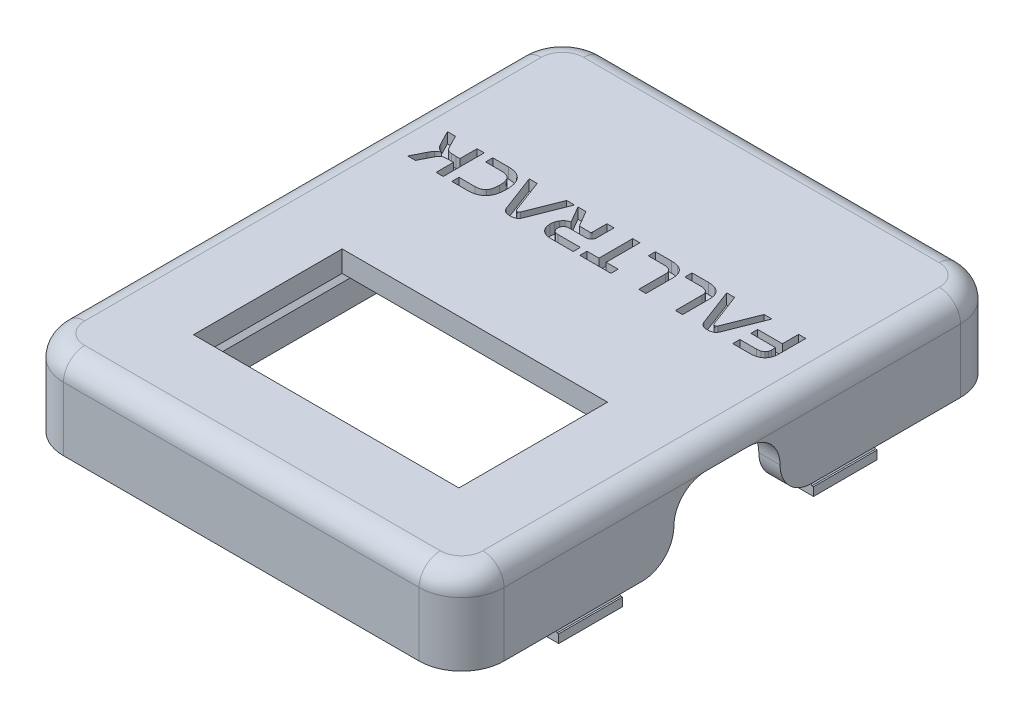
from build123d import *

# Parameters (mm, degrees)
SKETCH1_W            = 41.5
SKETCH1_H            = 51
SKETCH1_W_2          = 37.5
SKETCH1_H_2          = 47
BOSS_EXTRUDE1_DEPTH  = 6
SKETCH2_W            = 41.5
SKETCH2_H            = 51
BOSS_EXTRUDE2_DEPTH  = 2
FILLET1_R            = 4
SKETCH4_R            = 0.95
BOSS_EXTRUDE3_DEPTH  = 5
SKETCH6_W            = 25
SKETCH6_H            = 16.5
CUT_EXTRUDE1_DEPTH   = 34.41874474
SKETCH7_W            = 4.5
SKETCH7_H            = 2
SKETCH7_W_2          = 2.154325197
SKETCH7_H_2          = 4
BOSS_EXTRUDE4_DEPTH  = 5
SKETCH8_R            = 1.95
BOSS_EXTRUDE5_DEPTH  = 3
FILLET2_R            = 2
SKETCH9_W            = 2
SKETCH9_H            = 10
CUT_EXTRUDE2_DEPTH   = 6
FILLET3_R            = 3
SKETCH11_W           = 32
SKETCH11_H           = 3.5
BOSS_EXTRUDE6_DEPTH  = 1.5
CHAMFER1_SIZE        = 1
CHAMFER2_SIZE        = 0.5
SKETCH12_W           = 32
SKETCH12_H           = 0.8
BOSS_EXTRUDE7_DEPTH  = 0.65
CHAMFER3_SIZE        = 0.5
SKETCH13_W           = 6
SKETCH13_H           = 3.5
BOSS_EXTRUDE8_DEPTH  = 1.5
CHAMFER4_START       = -15
CHAMFER4_DEPTH       = 6
CHAMFER4_START_2     = 9
CHAMFER4_2_DEPTH     = 6
SKETCH14_W           = 6
SKETCH14_H           = 0.8
BOSS_EXTRUDE9_DEPTH  = 0.65
CHAMFER5_SIZE        = 0.5
CUT_EXTRUDE4_START   = -1
CUT_EXTRUDE4_DEPTH   = 1
CUT_EXTRUDE5_START   = -3
SKETCH16_R           = 1.95
SKETCH16_R_2         = 0.95
CUT_EXTRUDE5_DEPTH   = 3
CUT_EXTRUDE6_START   = -2
SKETCH17_R           = 0.95
CUT_EXTRUDE6_DEPTH   = 2
CHAMFER6_SIZE        = 2
CUT_EXTRUDE7_DEPTH   = 2
SKETCH18_W           = 25
SKETCH18_H           = 2.5
BOSS_EXTRUDE10_DEPTH = 2


with BuildPart() as part:
    # Sketch1 → Boss-Extrude1 (new body)
    with BuildSketch(Plane(origin=(0, 0, 0), x_dir=(1, 0, 0), z_dir=(0, 1, 0))):
        Rectangle(SKETCH1_W, SKETCH1_H)
        Rectangle(SKETCH1_W_2, SKETCH1_H_2, mode=Mode.SUBTRACT)
    extrude(amount=BOSS_EXTRUDE1_DEPTH)

    # Sketch2 → Boss-Extrude2 (add)
    with BuildSketch(Plane(origin=(0, 6, 0), x_dir=(1, 0, 0), z_dir=(0, 1, 0))):
        Rectangle(SKETCH2_W, SKETCH2_H)
    extrude(amount=BOSS_EXTRUDE2_DEPTH)

    # Fillet1
    fillet1_edges = [part.edges().sort_by_distance(p)[0] for p in [
        (20.75, 4, -25.5),
        (20.75, 4, 25.5),
        (-20.75, 4, 25.5),
        (-20.75, 4, -25.5),
    ]]
    fillet(fillet1_edges, radius=FILLET1_R)

    # Sketch4 → Boss-Extrude3 (add)
    with BuildSketch(Plane.XZ.offset(-6)):
        with Locations(Location((11.05, -2.05, 0), (0, 0, 90))):
            Circle(SKETCH4_R)
        with Locations(Location((11.05, 20.05, 0), (0, 0, 270))):
            Circle(SKETCH4_R)
        with Locations(Location((-11.05, -2.05, 0), (0, 0, 90))):
            Circle(SKETCH4_R)
        with Locations(Location((-11.05, 20.05, 0), (0, 0, 90))):
            Circle(SKETCH4_R)
    extrude(amount=BOSS_EXTRUDE3_DEPTH)

    # Sketch6 → Cut-Extrude1 (cut, through all)
    with BuildSketch(Plane.XZ.offset(-6)):
        with Locations((0, 9.25)):
            Rectangle(SKETCH6_W, SKETCH6_H)
    extrude(amount=-CUT_EXTRUDE1_DEPTH, mode=Mode.SUBTRACT)

    # Sketch7 → Boss-Extrude4 (add)
    with BuildSketch(Plane.XZ.offset(-6)):
        with Locations((-16.5, -22.5)):
            Rectangle(SKETCH7_W, SKETCH7_H)
        with Locations((-16.5, -6.5)):
            Rectangle(SKETCH7_W, SKETCH7_H)
        with Locations((1.077162598, -14.5)):
            Rectangle(SKETCH7_W_2, SKETCH7_H_2)
    extrude(amount=BOSS_EXTRUDE4_DEPTH)

    # Sketch8 → Boss-Extrude5 (add)
    with BuildSketch(Plane.XZ.offset(-6)):
        with Locations(Location((11.05, -2.05, 0), (0, 0, 90))):
            Circle(SKETCH8_R)
        with Locations(Location((-11.05, -2.05, 0), (0, 0, 90))):
            Circle(SKETCH8_R)
        with Locations(Location((11.05, 20.05, 0), (0, 0, 90))):
            Circle(SKETCH8_R)
        with Locations(Location((-11.05, 20.05, 0), (0, 0, 90))):
            Circle(SKETCH8_R)
    extrude(amount=BOSS_EXTRUDE5_DEPTH)

    # Fillet2
    fillet2_edges = [part.edges().sort_by_distance(p)[0] for p in [
        (0, 8, 25.5),
        (-20.75, 8, 0),
        (20.75, 8, 0),
        (0, 8, -25.5),
        (-19.578427125, 8, -24.328427125),
        (19.578427125, 8, -24.328427125),
        (19.578427125, 8, 24.328427125),
        (-19.578427125, 8, 24.328427125),
    ]]
    fillet(fillet2_edges, radius=FILLET2_R)

    # Sketch9 → Cut-Extrude2 (cut)
    with BuildSketch(Plane.XZ):
        with Locations((19.75, 0.5)):
            Rectangle(SKETCH9_W, SKETCH9_H)
    extrude(amount=-CUT_EXTRUDE2_DEPTH, mode=Mode.SUBTRACT)

    # Fillet3
    fillet3_edges = [part.edges().sort_by_distance(p)[0] for p in [
        (19.75, 6, 5.5),
        (19.75, 6, -4.5),
    ]]
    fillet(fillet3_edges, radius=FILLET3_R)
    fillet3_2_edges = [part.edges().sort_by_distance(p)[0] for p in [
        (19.75, 0, 5.5),
        (19.75, 0, -4.5),
    ]]
    fillet(fillet3_2_edges, radius=FILLET3_R - 0.0001)  # a hair under: the kernel refuses the full size

    # Sketch11 → Boss-Extrude6 (add)
    with BuildSketch(Plane(origin=(-18.75, 0, 0), x_dir=(0, 0, -1), z_dir=(1, 0, 0))):
        with Locations((0, -0.75)):
            Rectangle(SKETCH11_W, SKETCH11_H)
    extrude(amount=BOSS_EXTRUDE6_DEPTH)

    # Chamfer1
    chamfer1_edges = [part.edges().sort_by_distance(p)[0] for p in [
        (-18.75, 1, 5.25),
        (-17.25, 1, -11.75),
    ]]
    chamfer(chamfer1_edges, length=CHAMFER1_SIZE)

    # Chamfer2
    chamfer2_edges = [part.edges().sort_by_distance(p)[0] for p in [
        (-17.25, 1, 5.25),
    ]]
    chamfer(chamfer2_edges, length=CHAMFER2_SIZE - 0.0001)  # a hair under: the kernel refuses the full size

    # Sketch12 → Boss-Extrude7 (add)
    with BuildSketch(Plane.ZY.offset(18.75)):
        with Locations((0, -2.1)):
            Rectangle(SKETCH12_W, SKETCH12_H)
    extrude(amount=BOSS_EXTRUDE7_DEPTH)

    # Chamfer3
    chamfer3_edges = [part.edges().sort_by_distance(p)[0] for p in [
        (-18.75, -1.7, 0),
    ]]
    chamfer(chamfer3_edges, length=CHAMFER3_SIZE)

    # Sketch13 → Boss-Extrude8 (add)
    with BuildSketch(Plane.ZY.offset(-18.75)):
        with Locations((12, -0.75)):
            Rectangle(SKETCH13_W, SKETCH13_H)
        with Locations((-12, -0.75)):
            Rectangle(SKETCH13_W, SKETCH13_H)
    extrude(amount=BOSS_EXTRUDE8_DEPTH)

    # Chamfer4: read off the stored shape, not the designer's step
    # Chamfer4 outline → Chamfer4 (add)
    with BuildSketch(Plane.XY.offset(CHAMFER4_START)):
        Polygon((18.75, 3), (17.25, 1.5), (17.25, 1), (18.75, 1), align=None)
    extrude(amount=CHAMFER4_DEPTH)

    # Chamfer4 2 outline → Chamfer4 2 (add)
    with BuildSketch(Plane.XY.offset(CHAMFER4_START_2)):
        Polygon((18.75, 3), (17.25, 1.5), (17.25, 1), (18.75, 1), align=None)
    extrude(amount=CHAMFER4_2_DEPTH)

    # Sketch14 → Boss-Extrude9 (add)
    with BuildSketch(Plane(origin=(18.75, 0, 0), x_dir=(0, 0, -1), z_dir=(1, 0, 0))):
        with Locations((12, -2.1)):
            Rectangle(SKETCH14_W, SKETCH14_H)
        with Locations((-12, -2.1)):
            Rectangle(SKETCH14_W, SKETCH14_H)
    extrude(amount=BOSS_EXTRUDE9_DEPTH)

    # Chamfer5
    chamfer5_edges = [part.edges().sort_by_distance(p)[0] for p in [
        (-17.25, -2.5, 0),
        (17.25, -2.5, 12),
        (17.25, -2.5, -12),
        (18.75, -1.7, -12),
        (18.75, -1.7, 12),
    ]]
    chamfer(chamfer5_edges, length=CHAMFER5_SIZE)

    # Cut-Extrude4: read off the stored shape, not the designer's step
    # Cut-Extrude4 outline → Cut-Extrude4 (cut)
    with BuildSketch(Plane(origin=(0, 8, 0), x_dir=(1, 0, 0), z_dir=(0, 1, 0)).offset(CUT_EXTRUDE4_START)):
        with BuildLine():
            add(Edge.make_bspline(
                [(-15.135868732, 9.429192035), (-15.021534625, 9.419735248), (-14.872939044, 9.41492934), (-14.690081989, 9.41492934)],
                knots=[21, 21, 21, 21, 22, 22, 22, 22], degree=3))
            add(Edge.make_bspline(
                [(-15.421587726, 9.494924457), (-15.345313312, 9.460662982), (-15.250125323, 9.438726337), (-15.135868732, 9.429192035)],
                knots=[20, 20, 20, 20, 21, 21, 21, 21], degree=3))
            add(Edge.make_bspline(
                [(-15.610180865, 9.637783954), (-15.560649005, 9.57685744), (-15.497784625, 9.529185931), (-15.421587726, 9.494924457)],
                knots=[19, 19, 19, 19, 20, 20, 20, 20], degree=3))
            add(Edge.make_bspline(
                [(-15.76451253, 9.883505389), (-15.711104938, 9.780643451), (-15.659635211, 9.698787982), (-15.610180865, 9.637783954)],
                knots=[18, 18, 18, 18, 19, 19, 19, 19], degree=3))
            Line((-15.76451253, 9.883505389), (-16.35315877, 11.026536395))
            Line((-16.35315877, 11.026536395), (-17.107531329, 11.026536395))
            Line((-17.107531329, 11.026536395), (-16.484623614, 9.81498244))
            add(Edge.make_bspline(
                [(-16.318819781, 9.526317889), (-16.372149859, 9.608328387), (-16.427417804, 9.704524066), (-16.484623614, 9.81498244)],
                knots=[14, 14, 14, 14, 15, 15, 15, 15], degree=3))
            add(Edge.make_bspline(
                [(-16.150225421, 9.314857929), (-16.209291583, 9.374001605), (-16.265489703, 9.444462421), (-16.318819781, 9.526317889)],
                knots=[13, 13, 13, 13, 14, 14, 14, 14], degree=3))
            add(Edge.make_bspline(
                [(-15.958841754, 9.166339862), (-16.027364703, 9.206337421), (-16.091159259, 9.255869281), (-16.150225421, 9.314857929)],
                knots=[12, 12, 12, 12, 13, 13, 13, 13], degree=3))
            add(Edge.make_bspline(
                [(-15.718778888, 9.072004535), (-15.810246173, 9.094871356), (-15.89024129, 9.126264789), (-15.958841754, 9.166339862)],
                knots=[11, 11, 11, 11, 12, 12, 12, 12], degree=3))
            add(Edge.make_bspline(
                [(-16.10735982, 8.797680194), (-16.0082961, 8.912014301), (-15.878769122, 9.003404071), (-15.718778888, 9.072004535)],
                knots=[10, 10, 10, 10, 11, 11, 11, 11], degree=3))
            add(Edge.make_bspline(
                [(-16.387420245, 8.369024189), (-16.299751178, 8.540486591), (-16.206423541, 8.683423603), (-16.10735982, 8.797680194)],
                knots=[9, 9, 9, 9, 10, 10, 10, 10], degree=3))
            Line((-16.387420245, 8.369024189), (-16.993197222, 7.168942402))
            Line((-16.993197222, 7.168942402), (-16.267427569, 7.168942402))
            Line((-16.267427569, 7.168942402), (-15.678781329, 8.323368061))
            add(Edge.make_bspline(
                [(-15.527317706, 8.577693622), (-15.5749117, 8.514829242), (-15.625373736, 8.430028217), (-15.678781329, 8.323368061)],
                knots=[5, 5, 5, 5, 6, 6, 6, 6], degree=3))
            add(Edge.make_bspline(
                [(-15.352987262, 8.723421161), (-15.421587726, 8.689082172), (-15.479646197, 8.640558002), (-15.527317706, 8.577693622)],
                knots=[4, 4, 4, 4, 5, 5, 5, 5], degree=3))
            add(Edge.make_bspline(
                [(-15.093003131, 8.789076068), (-15.197725421, 8.779619281), (-15.284464313, 8.757682636), (-15.352987262, 8.723421161)],
                knots=[3, 3, 3, 3, 4, 4, 4, 4], degree=3))
            add(Edge.make_bspline(
                [(-14.690081989, 8.803416278), (-14.853870441, 8.803416278), (-14.988125812, 8.798687885), (-15.093003131, 8.789076068)],
                knots=[2, 2, 2, 2, 3, 3, 3, 3], degree=3))
            Line((-14.690081989, 8.803416278), (-14.318631793, 8.803416278))
            Line((-14.318631793, 8.803416278), (-14.318631793, 7.168942402))
            Line((-14.318631793, 7.168942402), (-13.644254352, 7.168942402))
            Line((-13.644254352, 7.168942402), (-13.644254352, 11.026536395))
            Line((-13.644254352, 11.026536395), (-14.318631793, 11.026536395))
            Line((-14.318631793, 11.026536395), (-14.318631793, 9.41492934))
            Line((-14.318631793, 9.41492934), (-14.690081989, 9.41492934))
        make_face()
        with BuildLine():
            add(Edge.make_bspline(
                [(-10.052380574, 7.646122577), (-10.351432087, 7.32800246), (-10.782956135, 7.168942402), (-11.346875202, 7.168942402)],
                knots=[12, 12, 12, 12, 13, 13, 13, 13], degree=3))
            add(Edge.make_bspline(
                [(-9.603725789, 9.10060744), (-9.603725789, 8.44909682), (-9.753251546, 7.964242694), (-10.052380574, 7.646122577)],
                knots=[11, 11, 11, 11, 12, 12, 12, 12], degree=3))
            add(Edge.make_bspline(
                [(-10.052380574, 10.549356219), (-9.753251546, 10.231236102), (-9.603725789, 9.748319842), (-9.603725789, 9.10060744)],
                knots=[10, 10, 10, 10, 11, 11, 11, 11], degree=3))
            add(Edge.make_bspline(
                [(-11.346875202, 11.026536395), (-10.782956135, 11.026536395), (-10.351432087, 10.867476336), (-10.052380574, 10.549356219)],
                knots=[9, 9, 9, 9, 10, 10, 10, 10], degree=3))
            Line((-11.346875202, 11.026536395), (-12.838489582, 11.026536395))
            Line((-12.838489582, 11.026536395), (-12.838489582, 10.352158954))
            Line((-12.838489582, 10.352158954), (-11.346875202, 10.352158954))
            add(Edge.make_bspline(
                [(-10.529560749, 10.057835834), (-10.697224934, 10.254102923), (-10.969611409, 10.352158954), (-11.346875202, 10.352158954)],
                knots=[5, 5, 5, 5, 6, 6, 6, 6], degree=3))
            add(Edge.make_bspline(
                [(-10.27810323, 9.10060744), (-10.27810323, 9.542595966), (-10.361896565, 9.861646258), (-10.529560749, 10.057835834)],
                knots=[4, 4, 4, 4, 5, 5, 5, 5], degree=3))
            add(Edge.make_bspline(
                [(-10.532428791, 8.137565448), (-10.362904255, 8.333910053), (-10.27810323, 8.654820697), (-10.27810323, 9.10060744)],
                knots=[3, 3, 3, 3, 4, 4, 4, 4], degree=3))
            add(Edge.make_bspline(
                [(-11.346875202, 7.843319843), (-10.973409626, 7.843319843), (-10.701953328, 7.941453388), (-10.532428791, 8.137565448)],
                knots=[2, 2, 2, 2, 3, 3, 3, 3], degree=3))
            Line((-11.346875202, 7.843319843), (-12.838489582, 7.843319843))
            Line((-12.838489582, 7.843319843), (-12.838489582, 7.168942402))
            Line((-12.838489582, 7.168942402), (-11.346875202, 7.168942402))
        make_face()
        with BuildLine():
            add(Edge.make_bspline(
                [(-7.294951986, 7.791850116), (-7.2034847, 7.791850116), (-7.138682454, 7.835723407), (-7.100622762, 7.92331496)],
                knots=[10, 10, 10, 10, 11, 11, 11, 11], degree=3))
            add(Edge.make_bspline(
                [(-7.483545125, 7.92331496), (-7.449283651, 7.835723407), (-7.386419271, 7.791850116), (-7.294951986, 7.791850116)],
                knots=[9, 9, 9, 9, 10, 10, 10, 10], degree=3))
            Line((-7.483545125, 7.92331496), (-8.655101521, 11.026536395))
            Line((-8.655101521, 11.026536395), (-9.40381551, 11.026536395))
            Line((-9.40381551, 11.026536395), (-8.100794271, 7.597520893))
            add(Edge.make_bspline(
                [(-7.800735067, 7.211808002), (-7.93219991, 7.286067035), (-8.032193807, 7.414663837), (-8.100794271, 7.597520893)],
                knots=[5, 5, 5, 5, 6, 6, 6, 6], degree=3))
            add(Edge.make_bspline(
                [(-7.30068807, 7.100341938), (-7.502536214, 7.100341938), (-7.669270223, 7.137471454), (-7.800735067, 7.211808002)],
                knots=[4, 4, 4, 4, 5, 5, 5, 5], degree=3))
            add(Edge.make_bspline(
                [(-6.794904989, 7.211808002), (-6.926369832, 7.137471454), (-7.094964193, 7.100341938), (-7.30068807, 7.100341938)],
                knots=[3, 3, 3, 3, 4, 4, 4, 4], degree=3))
            add(Edge.make_bspline(
                [(-6.489109701, 7.597520893), (-6.561430868, 7.414663837), (-6.663440145, 7.286067035), (-6.794904989, 7.211808002)],
                knots=[2, 2, 2, 2, 3, 3, 3, 3], degree=3))
            Line((-6.489109701, 7.597520893), (-5.134696249, 11.026536395))
            Line((-5.134696249, 11.026536395), (-5.877596639, 11.026536395))
            Line((-5.877596639, 11.026536395), (-7.100622762, 7.92331496))
        make_face()
        with BuildLine():
            add(Edge.make_bspline(
                [(-3.925932821, 7.994705951), (-3.84020162, 7.893859394), (-3.703930868, 7.843319843), (-3.51735311, 7.843319843)],
                knots=[24, 24, 24, 24, 25, 25, 25, 25], degree=3))
            add(Edge.make_bspline(
                [(-4.054529623, 8.351893451), (-4.054529623, 8.214770038), (-4.011664023, 8.095707538), (-3.925932821, 7.994705951)],
                knots=[23, 23, 23, 23, 24, 24, 24, 24], degree=3))
            add(Edge.make_bspline(
                [(-4.023136191, 8.551958759), (-4.043987631, 8.487234027), (-4.054529623, 8.420493915), (-4.054529623, 8.351893451)],
                knots=[22, 22, 22, 22, 23, 23, 23, 23], degree=3))
            add(Edge.make_bspline(
                [(-3.928800863, 8.723421161), (-3.970658774, 8.673889301), (-4.002129721, 8.616761005), (-4.023136191, 8.551958759)],
                knots=[21, 21, 21, 21, 22, 22, 22, 22], degree=3))
            add(Edge.make_bspline(
                [(-3.763074545, 8.843413837), (-3.831675009, 8.81295058), (-3.886865439, 8.772953021), (-3.928800863, 8.723421161)],
                knots=[20, 20, 20, 20, 21, 21, 21, 21], degree=3))
            add(Edge.make_bspline(
                [(-3.51735311, 8.889147479), (-3.612541098, 8.889147479), (-3.694474081, 8.873954608), (-3.763074545, 8.843413837)],
                knots=[19, 19, 19, 19, 20, 20, 20, 20], degree=3))
            Line((-3.51735311, 8.889147479), (-2.014266562, 8.889147479))
            add(Edge.make_bspline(
                [(-1.551349082, 9.032006976), (-1.64653707, 8.936818988), (-1.800868735, 8.889147479), (-2.014266562, 8.889147479)],
                knots=[17, 17, 17, 17, 18, 18, 18, 18], degree=3))
            add(Edge.make_bspline(
                [(-1.408489585, 9.500660541), (-1.408489585, 9.283464496), (-1.456083579, 9.127272479), (-1.551349082, 9.032006976)],
                knots=[16, 16, 16, 16, 17, 17, 17, 17], degree=3))
            Line((-1.408489585, 9.500660541), (-1.408489585, 11.026536395))
            Line((-1.408489585, 11.026536395), (-2.082867026, 11.026536395))
            Line((-2.082867026, 11.026536395), (-2.082867026, 9.63204787))
            add(Edge.make_bspline(
                [(-2.17999288, 9.534922015), (-2.115190634, 9.534922015), (-2.082867026, 9.567323138), (-2.082867026, 9.63204787)],
                knots=[12, 12, 12, 12, 13, 13, 13, 13], degree=3))
            Line((-2.17999288, 9.534922015), (-3.185822958, 9.534922015))
            Line((-3.185822958, 9.534922015), (-4.065924276, 11.026536395))
            Line((-4.065924276, 11.026536395), (-4.814638266, 11.026536395))
            Line((-4.814638266, 11.026536395), (-3.91740621, 9.483452289))
            add(Edge.make_bspline(
                [(-4.294592489, 9.300595233), (-4.191730551, 9.38059035), (-4.065924276, 9.441594379), (-3.91740621, 9.483452289)],
                knots=[7, 7, 7, 7, 8, 8, 8, 8], degree=3))
            add(Edge.make_bspline(
                [(-4.546050009, 9.02340285), (-4.481170248, 9.12828017), (-4.397454428, 9.220600116), (-4.294592489, 9.300595233)],
                knots=[6, 6, 6, 6, 7, 7, 7, 7], degree=3))
            add(Edge.make_bspline(
                [(-4.688909506, 8.68621413), (-4.658368734, 8.80628432), (-4.61077474, 8.91868056), (-4.546050009, 9.02340285)],
                knots=[5, 5, 5, 5, 6, 6, 6, 6], degree=3))
            add(Edge.make_bspline(
                [(-4.734643148, 8.323368061), (-4.734643148, 8.445298603), (-4.719372763, 8.566221454), (-4.688909506, 8.68621413)],
                knots=[4, 4, 4, 4, 5, 5, 5, 5], degree=3))
            add(Edge.make_bspline(
                [(-4.663174643, 7.883317402), (-4.710768637, 8.024316547), (-4.734643148, 8.170974262), (-4.734643148, 8.323368061)],
                knots=[3, 3, 3, 3, 4, 4, 4, 4], degree=3))
            add(Edge.make_bspline(
                [(-4.440320028, 7.514657734), (-4.541166586, 7.619535053), (-4.615503134, 7.742395771), (-4.663174643, 7.883317402)],
                knots=[2, 2, 2, 2, 3, 3, 3, 3], degree=3))
            add(Edge.make_bspline(
                [(-4.054529623, 7.263200214), (-4.21072164, 7.326064594), (-4.339318441, 7.409935444), (-4.440320028, 7.514657734)],
                knots=[1, 1, 1, 1, 2, 2, 2, 2], degree=3))
            add(Edge.make_bspline(
                [(-3.494486288, 7.168942402), (-3.711604819, 7.168942402), (-3.898260092, 7.200335834), (-4.054529623, 7.263200214)],
                knots=[0, 0, 0, 0, 1, 1, 1, 1], degree=3))
            Line((-3.494486288, 7.168942402), (-1.402753501, 7.168942402))
            Line((-1.402753501, 7.168942402), (-1.402753501, 7.843319843))
            Line((-1.402753501, 7.843319843), (-3.51735311, 7.843319843))
        make_face()
        with BuildLine():
            add(Edge.make_bspline(
                [(5.366523231, 10.229298236), (5.417992958, 10.067370135), (5.443650306, 9.889241473), (5.443650306, 9.69491225)],
                knots=[11, 11, 11, 11, 12, 12, 12, 12], degree=3))
            add(Edge.make_bspline(
                [(5.117933753, 10.649350116), (5.232190345, 10.531295306), (5.315131019, 10.391303851), (5.366523231, 10.229298236)],
                knots=[10, 10, 10, 10, 11, 11, 11, 11], degree=3))
            add(Edge.make_bspline(
                [(4.675015052, 10.926542498), (4.856011756, 10.859879901), (5.003599647, 10.76748244), (5.117933753, 10.649350116)],
                knots=[9, 9, 9, 9, 10, 10, 10, 10], degree=3))
            add(Edge.make_bspline(
                [(4.02063639, 11.026536395), (4.275969642, 11.026536395), (4.494095863, 10.993205096), (4.675015052, 10.926542498)],
                knots=[8, 8, 8, 8, 9, 9, 9, 9], degree=3))
            Line((4.02063639, 11.026536395), (2.483288368, 11.026536395))
            Line((2.483288368, 11.026536395), (2.483288368, 10.352158954))
            Line((2.483288368, 10.352158954), (3.980638832, 10.352158954))
            add(Edge.make_bspline(
                [(4.360693153, 10.300766742), (4.259769081, 10.335028216), (4.133032631, 10.352158954), (3.980638832, 10.352158954)],
                knots=[4, 4, 4, 4, 5, 5, 5, 5], degree=3))
            add(Edge.make_bspline(
                [(4.603546547, 10.160697772), (4.542697548, 10.219841449), (4.46169474, 10.266427752), (4.360693153, 10.300766742)],
                knots=[3, 3, 3, 3, 4, 4, 4, 4], degree=3))
            add(Edge.make_bspline(
                [(4.732143348, 9.949237811), (4.707416175, 10.031248309), (4.664550575, 10.101709125), (4.603546547, 10.160697772)],
                knots=[2, 2, 2, 2, 3, 3, 3, 3], degree=3))
            add(Edge.make_bspline(
                [(4.769272865, 9.68925368), (4.769272865, 9.780643451), (4.75702555, 9.867382342), (4.732143348, 9.949237811)],
                knots=[1, 1, 1, 1, 2, 2, 2, 2], degree=3))
            Line((4.769272865, 9.68925368), (4.769272865, 7.168942402))
            Line((4.769272865, 7.168942402), (5.443650306, 7.168942402))
            Line((5.443650306, 7.168942402), (5.443650306, 9.69491225))
        make_face()
        with BuildLine():
            add(Edge.make_bspline(
                [(8.818405554, 10.229298236), (8.869875281, 10.067370135), (8.895532629, 9.889241473), (8.895532629, 9.69491225)],
                knots=[11, 11, 11, 11, 12, 12, 12, 12], degree=3))
            add(Edge.make_bspline(
                [(8.569816077, 10.649350116), (8.684072669, 10.531295306), (8.767013342, 10.391303851), (8.818405554, 10.229298236)],
                knots=[10, 10, 10, 10, 11, 11, 11, 11], degree=3))
            add(Edge.make_bspline(
                [(8.126897376, 10.926542498), (8.30789408, 10.859879901), (8.45548197, 10.76748244), (8.569816077, 10.649350116)],
                knots=[9, 9, 9, 9, 10, 10, 10, 10], degree=3))
            add(Edge.make_bspline(
                [(7.472518714, 11.026536395), (7.727851966, 11.026536395), (7.945978186, 10.993205096), (8.126897376, 10.926542498)],
                knots=[8, 8, 8, 8, 9, 9, 9, 9], degree=3))
            Line((7.472518714, 11.026536395), (5.935170692, 11.026536395))
            Line((5.935170692, 11.026536395), (5.935170692, 10.352158954))
            Line((5.935170692, 10.352158954), (7.432521155, 10.352158954))
            add(Edge.make_bspline(
                [(7.812575476, 10.300766742), (7.711651404, 10.335028216), (7.584914954, 10.352158954), (7.432521155, 10.352158954)],
                knots=[4, 4, 4, 4, 5, 5, 5, 5], degree=3))
            add(Edge.make_bspline(
                [(8.05542887, 10.160697772), (7.994579871, 10.219841449), (7.913577063, 10.266427752), (7.812575476, 10.300766742)],
                knots=[3, 3, 3, 3, 4, 4, 4, 4], degree=3))
            add(Edge.make_bspline(
                [(8.184025672, 9.949237811), (8.159298499, 10.031248309), (8.116432898, 10.101709125), (8.05542887, 10.160697772)],
                knots=[2, 2, 2, 2, 3, 3, 3, 3], degree=3))
            add(Edge.make_bspline(
                [(8.221155188, 9.68925368), (8.221155188, 9.780643451), (8.208907874, 9.867382342), (8.184025672, 9.949237811)],
                knots=[1, 1, 1, 1, 2, 2, 2, 2], degree=3))
            Line((8.221155188, 9.68925368), (8.221155188, 7.168942402))
            Line((8.221155188, 7.168942402), (8.895532629, 7.168942402))
            Line((8.895532629, 7.168942402), (8.895532629, 9.69491225))
        make_face()
        with BuildLine():
            add(Edge.make_bspline(
                [(11.3073234, 7.791850116), (11.398790685, 7.791850116), (11.463592932, 7.835723407), (11.501652624, 7.92331496)],
                knots=[10, 10, 10, 10, 11, 11, 11, 11], degree=3))
            add(Edge.make_bspline(
                [(11.118730261, 7.92331496), (11.152991735, 7.835723407), (11.215856115, 7.791850116), (11.3073234, 7.791850116)],
                knots=[9, 9, 9, 9, 10, 10, 10, 10], degree=3))
            Line((11.118730261, 7.92331496), (9.947173865, 11.026536395))
            Line((9.947173865, 11.026536395), (9.198459876, 11.026536395))
            Line((9.198459876, 11.026536395), (10.501481115, 7.597520893))
            add(Edge.make_bspline(
                [(10.801540319, 7.211808002), (10.670075476, 7.286067035), (10.570081579, 7.414663837), (10.501481115, 7.597520893)],
                knots=[5, 5, 5, 5, 6, 6, 6, 6], degree=3))
            add(Edge.make_bspline(
                [(11.301587316, 7.100341938), (11.099739172, 7.100341938), (10.933005163, 7.137471454), (10.801540319, 7.211808002)],
                knots=[4, 4, 4, 4, 5, 5, 5, 5], degree=3))
            add(Edge.make_bspline(
                [(11.807370397, 7.211808002), (11.675905554, 7.137471454), (11.507311193, 7.100341938), (11.301587316, 7.100341938)],
                knots=[3, 3, 3, 3, 4, 4, 4, 4], degree=3))
            add(Edge.make_bspline(
                [(12.113165685, 7.597520893), (12.040844518, 7.414663837), (11.938835241, 7.286067035), (11.807370397, 7.211808002)],
                knots=[2, 2, 2, 2, 3, 3, 3, 3], degree=3))
            Line((12.113165685, 7.597520893), (13.467579137, 11.026536395))
            Line((13.467579137, 11.026536395), (12.724678747, 11.026536395))
            Line((12.724678747, 11.026536395), (11.501652624, 7.92331496))
        make_face()
        with BuildLine():
            add(Edge.make_bspline(
                [(15.876501866, 7.268936298), (15.695582677, 7.202273701), (15.477456456, 7.168942402), (15.222123204, 7.168942402)],
                knots=[16, 16, 16, 16, 17, 17, 17, 17], degree=3))
            add(Edge.make_bspline(
                [(16.319420567, 7.546128681), (16.205163975, 7.428073871), (16.05749857, 7.335598896), (15.876501866, 7.268936298)],
                knots=[15, 15, 15, 15, 16, 16, 16, 16], degree=3))
            add(Edge.make_bspline(
                [(16.568010045, 7.966180561), (16.516617833, 7.80425246), (16.433754673, 7.664261005), (16.319420567, 7.546128681)],
                knots=[14, 14, 14, 14, 15, 15, 15, 15], degree=3))
            add(Edge.make_bspline(
                [(16.645214634, 8.500489032), (16.645214634, 8.306159809), (16.619479771, 8.128108661), (16.568010045, 7.966180561)],
                knots=[13, 13, 13, 13, 14, 14, 14, 14], degree=3))
            Line((16.645214634, 8.500489032), (16.645214634, 11.026536395))
            Line((16.645214634, 11.026536395), (15.970837193, 11.026536395))
            Line((15.970837193, 11.026536395), (15.970837193, 9.500660541))
            Line((15.970837193, 9.500660541), (13.644777623, 9.500660541))
            Line((13.644777623, 9.500660541), (13.644777623, 8.860544574))
            Line((13.644777623, 8.860544574), (15.970837193, 8.860544574))
            Line((15.970837193, 8.860544574), (15.970837193, 8.494752948))
            add(Edge.make_bspline(
                [(15.933707677, 8.240504901), (15.958512364, 8.318639667), (15.970837193, 8.403363178), (15.970837193, 8.494752948)],
                knots=[5, 5, 5, 5, 6, 6, 6, 6], degree=3))
            add(Edge.make_bspline(
                [(15.805110875, 8.03470351), (15.866037388, 8.093847187), (15.908902989, 8.16244765), (15.933707677, 8.240504901)],
                knots=[4, 4, 4, 4, 5, 5, 5, 5], degree=3))
            add(Edge.make_bspline(
                [(15.559311925, 7.894712055), (15.662173863, 7.928973529), (15.744184361, 7.975714862), (15.805110875, 8.03470351)],
                knots=[3, 3, 3, 3, 4, 4, 4, 4], degree=3))
            add(Edge.make_bspline(
                [(15.176467076, 7.843319843), (15.328860875, 7.843319843), (15.456449986, 7.86045058), (15.559311925, 7.894712055)],
                knots=[2, 2, 2, 2, 3, 3, 3, 3], degree=3))
            Line((15.176467076, 7.843319843), (13.621988317, 7.843319843))
            Line((13.621988317, 7.843319843), (13.621988317, 7.168942402))
            Line((13.621988317, 7.168942402), (15.222123204, 7.168942402))
        make_face()
        Polygon((1.026012978, 11.026536395), (0.345976968, 11.026536395), (0.345976968, 7.843319843), (-0.779923301, 7.843319843), (-0.779923301, 7.168942402), (2.151913246, 7.168942402), (2.151913246, 7.843319843), (1.026012978, 7.843319843), align=None)
    extrude(amount=CUT_EXTRUDE4_DEPTH, mode=Mode.SUBTRACT)

    # Sketch16 → Cut-Extrude5 (cut)
    # profile 1 of 4: a face of its own
    with BuildSketch(Plane.XZ.offset(-3).offset(CUT_EXTRUDE5_START)):
        with Locations((11.05, -2.05)):
            Circle(SKETCH16_R)
        with Locations(Location((11.05, -2.05, 0), (0, 0, 270))):
            Circle(SKETCH16_R_2, mode=Mode.SUBTRACT)
    # profile 2 of 4: a face of its own
    with BuildSketch(Plane.XZ.offset(-3).offset(CUT_EXTRUDE5_START)):
        with Locations((11.05, 20.05)):
            Circle(SKETCH16_R)
        with Locations(Location((11.05, 20.05, 0), (0, 0, 270))):
            Circle(SKETCH16_R_2, mode=Mode.SUBTRACT)
    # profile 3 of 4: a face of its own
    with BuildSketch(Plane.XZ.offset(-3).offset(CUT_EXTRUDE5_START)):
        with Locations((-11.05, 20.05)):
            Circle(SKETCH16_R)
        with Locations(Location((-11.05, 20.05, 0), (0, 0, 270))):
            Circle(SKETCH16_R_2, mode=Mode.SUBTRACT)
    # profile 4 of 4: a face of its own
    with BuildSketch(Plane.XZ.offset(-3).offset(CUT_EXTRUDE5_START)):
        with Locations((-11.05, -2.05)):
            Circle(SKETCH16_R)
        with Locations(Location((-11.05, -2.05, 0), (0, 0, 90))):
            Circle(SKETCH16_R_2, mode=Mode.SUBTRACT)
    extrude(amount=CUT_EXTRUDE5_DEPTH, mode=Mode.SUBTRACT)

    # Sketch17 → Cut-Extrude6 (cut)
    with BuildSketch(Plane.XZ.offset(-1).offset(CUT_EXTRUDE6_START)):
        with Locations(Location((11.05, 20.05, 0), (0, 0, 270))):
            Circle(SKETCH17_R)
        with Locations(Location((-11.05, 20.05, 0), (0, 0, 270))):
            Circle(SKETCH17_R)
        with Locations(Location((-11.05, -2.05, 0), (0, 0, 270))):
            Circle(SKETCH17_R)
        with Locations(Location((11.05, -2.05, 0), (0, 0, 270))):
            Circle(SKETCH17_R)
    extrude(amount=CUT_EXTRUDE6_DEPTH, mode=Mode.SUBTRACT)

    # Chamfer6
    chamfer6_edges = [part.edges().sort_by_distance(p)[0] for p in [
        (2.154325197, 6, -14.5),
    ]]
    chamfer(chamfer6_edges, length=CHAMFER6_SIZE)

    # Sketch10 → Cut-Extrude7 (cut)
    with BuildSketch(Plane(origin=(-18.75, 0, 0), x_dir=(0, 0, -1), z_dir=(1, 0, 0))):
        with BuildLine():
            Line((11.25, 5.5), (17.75, 5.5))
            ThreePointArc((17.75, 5.5), (19.25, 4), (17.75, 2.5))
            Line((17.75, 2.5), (11.25, 2.5))
            ThreePointArc((11.25, 2.5), (9.75, 4), (11.25, 5.5))
        make_face()
    extrude(amount=-CUT_EXTRUDE7_DEPTH, mode=Mode.SUBTRACT)

    # Sketch18 → Boss-Extrude10 (add)
    with BuildSketch(Plane(origin=(0, 8, 0), x_dir=(1, 0, 0), z_dir=(0, 1, 0))):
        with Locations((0, -2.25)):
            Rectangle(SKETCH18_W, SKETCH18_H)
    extrude(amount=-BOSS_EXTRUDE10_DEPTH)


solid = part.part
